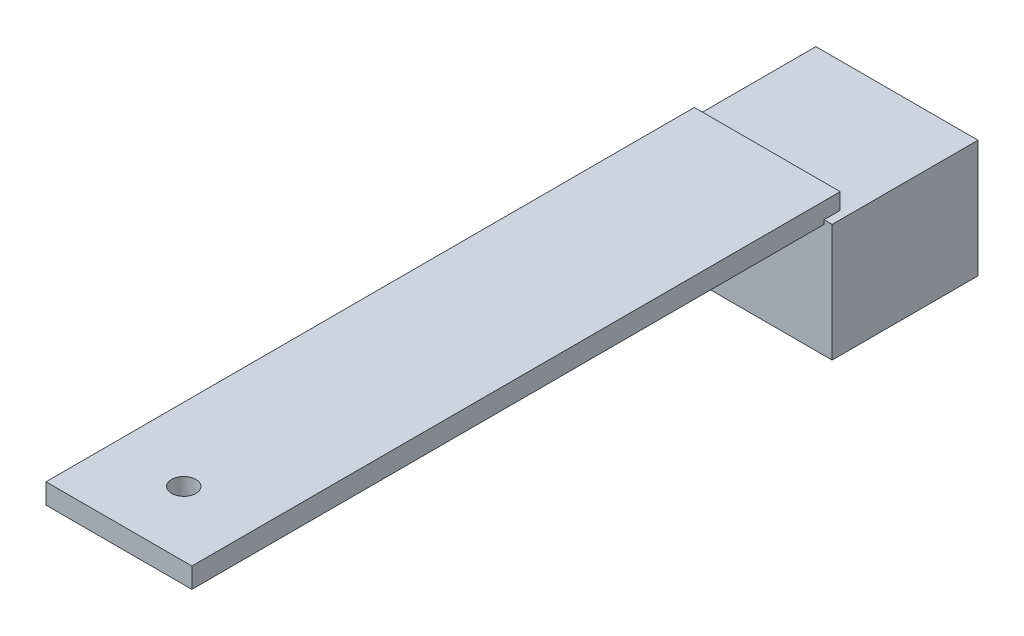
from build123d import *

# Parameters (mm, degrees)
S_BOX1_W     = 18
S_BOX1_H     = 2.5
BOSS_1_DEPTH = 80
S_BOX2_W     = 20
S_BOX2_H     = 14.5
BOSS_2_DEPTH = 18
S_HOLE3_R    = 1.5
HOLE_3_DEPTH = 2.7


with BuildPart() as part:
    # S_box1 → Boss_1 (new body)
    with BuildSketch(Plane.XY.offset(-72)):
        with Locations((0, 19.45)):
            Rectangle(S_BOX1_W, S_BOX1_H)
    extrude(amount=BOSS_1_DEPTH)

    # S_box2 → Boss_2 (add)
    with BuildSketch(Plane.XY.offset(-88)):
        with Locations((0, 11.45)):
            Rectangle(S_BOX2_W, S_BOX2_H)
    extrude(amount=BOSS_2_DEPTH)

    # S_hole3 → Hole_3 (cut)
    with BuildSketch(Plane(origin=(0, 18.1, 0), x_dir=(1, 0, 0), z_dir=(0, 1, 0))):
        Circle(S_HOLE3_R)
    extrude(amount=HOLE_3_DEPTH, mode=Mode.SUBTRACT)


solid = part.part
